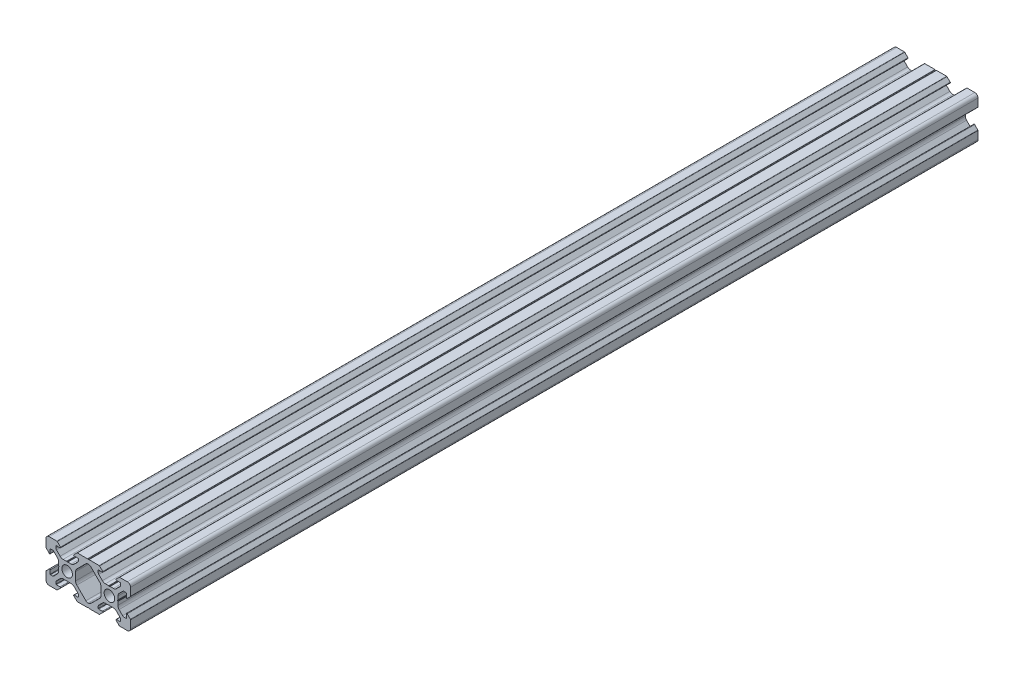
from build123d import *

# Parameters (mm, degrees)
MODEL_R    = 2.5
BODY_DEPTH = 401


with BuildPart() as part:
    # Model → Body (new body)
    with BuildSketch(Plane.XY):
        with BuildLine():
            Line((0.375693909, 9.662304735), (5.17, 9.662304735))
            ThreePointArc((5.17, 9.662304735), (5.265670858, 9.643274618), (5.346776695, 9.58908143))
            Line((5.346776695, 9.58908143), (6.846776695, 8.08908143))
            ThreePointArc((6.846776695, 8.08908143), (6.900969883, 7.816633877), (6.67, 7.662304735))
            Line((6.67, 7.662304735), (4.9, 7.662304735))
            ThreePointArc((4.9, 7.662304735), (4.758578644, 7.603726091), (4.7, 7.462304735))
            Line((4.7, 7.462304735), (4.7, 6.649310504))
            ThreePointArc((4.7, 6.649310504), (4.776120467, 6.266627071), (4.992893219, 5.942203722))
            Line((4.992893219, 5.942203722), (6.687005769, 4.248091173))
            ThreePointArc((6.687005769, 4.248091173), (7.335852466, 3.81454567), (8.101219331, 3.662304735))
            Line((8.101219331, 3.662304735), (9.662304735, 3.662304735))
            ThreePointArc((9.662304735, 3.662304735), (9.745056471, 3.648211815), (9.818478497, 3.607521938))
            Line((9.818478497, 3.607521938), (10, 3.462304735))
            Line((10, 3.462304735), (10.181521503, 3.607521938))
            ThreePointArc((10.181521503, 3.607521938), (10.254943529, 3.648211815), (10.337695265, 3.662304735))
            Line((10.337695265, 3.662304735), (11.898780669, 3.662304735))
            ThreePointArc((11.898780669, 3.662304735), (12.664147534, 3.81454567), (13.312994231, 4.248091173))
            Line((13.312994231, 4.248091173), (15.007106781, 5.942203722))
            ThreePointArc((15.007106781, 5.942203722), (15.223879533, 6.266627071), (15.3, 6.649310504))
            Line((15.3, 6.649310504), (15.3, 7.462304735))
            ThreePointArc((15.3, 7.462304735), (15.241421356, 7.603726091), (15.1, 7.662304735))
            Line((15.1, 7.662304735), (13.33, 7.662304735))
            ThreePointArc((13.33, 7.662304735), (13.099030117, 7.816633877), (13.153223305, 8.08908143))
            Line((13.153223305, 8.08908143), (14.653223305, 9.58908143))
            ThreePointArc((14.653223305, 9.58908143), (14.734329142, 9.643274618), (14.83, 9.662304735))
            Line((14.83, 9.662304735), (18.5, 9.662304735))
            ThreePointArc((18.5, 9.662304735), (19.560660172, 9.222964907), (20, 8.162304735))
            Line((20, 8.162304735), (20, 4.492304735))
            ThreePointArc((20, 4.492304735), (19.980969883, 4.396633877), (19.926776695, 4.31552804))
            Line((19.926776695, 4.31552804), (18.426776695, 2.81552804))
            ThreePointArc((18.426776695, 2.81552804), (18.154329142, 2.761334852), (18, 2.992304735))
            Line((18, 2.992304735), (18, 4.762304735))
            ThreePointArc((18, 4.762304735), (17.941421356, 4.903726091), (17.8, 4.962304735))
            Line((17.8, 4.962304735), (16.987005769, 4.962304735))
            ThreePointArc((16.987005769, 4.962304735), (16.604322336, 4.886184268), (16.279898987, 4.669411516))
            Line((16.279898987, 4.669411516), (14.585786438, 2.975298967))
            ThreePointArc((14.585786438, 2.975298967), (14.152240935, 2.326452269), (14, 1.561085404))
            Line((14, 1.561085404), (14, 0))
            ThreePointArc((14, 0), (13.98590708, -0.082751735), (13.945217202, -0.156173762))
            Line((13.945217202, -0.156173762), (13.8, -0.337695265))
            Line((13.8, -0.337695265), (13.945217202, -0.519216768))
            ThreePointArc((13.945217202, -0.519216768), (13.98590708, -0.592638794), (14, -0.67539053))
            Line((14, -0.67539053), (14, -2.236475934))
            ThreePointArc((14, -2.236475934), (14.152240935, -3.001842799), (14.585786438, -3.650689496))
            Line((14.585786438, -3.650689496), (16.279898987, -5.344802046))
            ThreePointArc((16.279898987, -5.344802046), (16.604322336, -5.561574797), (16.987005769, -5.637695265))
            Line((16.987005769, -5.637695265), (17.8, -5.637695265))
            ThreePointArc((17.8, -5.637695265), (17.941421356, -5.579116621), (18, -5.437695265))
            Line((18, -5.437695265), (18, -3.667695265))
            ThreePointArc((18, -3.667695265), (18.154329142, -3.436725382), (18.426776695, -3.49091857))
            Line((18.426776695, -3.49091857), (19.926776695, -4.99091857))
            ThreePointArc((19.926776695, -4.99091857), (19.980969883, -5.072024407), (20, -5.167695265))
            Line((20, -5.167695265), (20, -8.837695265))
            ThreePointArc((20, -8.837695265), (19.560660172, -9.898355437), (18.5, -10.337695265))
            Line((18.5, -10.337695265), (14.83, -10.337695265))
            ThreePointArc((14.83, -10.337695265), (14.734329142, -10.318665148), (14.653223305, -10.26447196))
            Line((14.653223305, -10.26447196), (13.153223305, -8.76447196))
            ThreePointArc((13.153223305, -8.76447196), (13.099030117, -8.492024407), (13.33, -8.337695265))
            Line((13.33, -8.337695265), (15.1, -8.337695265))
            ThreePointArc((15.1, -8.337695265), (15.241421356, -8.279116621), (15.3, -8.137695265))
            Line((15.3, -8.137695265), (15.3, -7.324701033))
            ThreePointArc((15.3, -7.324701033), (15.223879533, -6.942017601), (15.007106781, -6.617594252))
            Line((15.007106781, -6.617594252), (13.312994231, -4.923481702))
            ThreePointArc((13.312994231, -4.923481702), (12.664147534, -4.4899362), (11.898780669, -4.337695265))
            Line((11.898780669, -4.337695265), (10.337695265, -4.337695265))
            ThreePointArc((10.337695265, -4.337695265), (10.254943529, -4.323602345), (10.181521503, -4.282912467))
            Line((10.181521503, -4.282912467), (10, -4.137695265))
            Line((10, -4.137695265), (9.818478497, -4.282912467))
            ThreePointArc((9.818478497, -4.282912467), (9.745056471, -4.323602345), (9.662304735, -4.337695265))
            Line((9.662304735, -4.337695265), (8.101219331, -4.337695265))
            ThreePointArc((8.101219331, -4.337695265), (7.335852466, -4.4899362), (6.687005769, -4.923481702))
            Line((6.687005769, -4.923481702), (4.992893219, -6.617594252))
            ThreePointArc((4.992893219, -6.617594252), (4.776120467, -6.942017601), (4.7, -7.324701033))
            Line((4.7, -7.324701033), (4.7, -8.137695265))
            ThreePointArc((4.7, -8.137695265), (4.758578644, -8.279116621), (4.9, -8.337695265))
            Line((4.9, -8.337695265), (6.67, -8.337695265))
            ThreePointArc((6.67, -8.337695265), (6.900969883, -8.492024407), (6.846776695, -8.76447196))
            Line((6.846776695, -8.76447196), (5.346776695, -10.26447196))
            ThreePointArc((5.346776695, -10.26447196), (5.265670858, -10.318665148), (5.17, -10.337695265))
            Line((5.17, -10.337695265), (0.375693909, -10.337695265))
            ThreePointArc((0.375693909, -10.337695265), (0.303247872, -10.326968271), (0.23701886, -10.295707838))
            Line((0.23701886, -10.295707838), (0, -10.137695265))
            Line((0, -10.137695265), (-0.23701886, -10.295707838))
            ThreePointArc((-0.23701886, -10.295707838), (-0.303247872, -10.326968271), (-0.375693909, -10.337695265))
            Line((-0.375693909, -10.337695265), (-5.17, -10.337695265))
            ThreePointArc((-5.17, -10.337695265), (-5.265670858, -10.318665148), (-5.346776695, -10.26447196))
            Line((-5.346776695, -10.26447196), (-6.846776695, -8.76447196))
            ThreePointArc((-6.846776695, -8.76447196), (-6.900969883, -8.492024407), (-6.67, -8.337695265))
            Line((-6.67, -8.337695265), (-4.9, -8.337695265))
            ThreePointArc((-4.9, -8.337695265), (-4.758578644, -8.279116621), (-4.7, -8.137695265))
            Line((-4.7, -8.137695265), (-4.7, -7.324701033))
            ThreePointArc((-4.7, -7.324701033), (-4.776120467, -6.942017601), (-4.992893219, -6.617594252))
            Line((-4.992893219, -6.617594252), (-6.687005769, -4.923481702))
            ThreePointArc((-6.687005769, -4.923481702), (-7.335852466, -4.4899362), (-8.101219331, -4.337695265))
            Line((-8.101219331, -4.337695265), (-9.662304735, -4.337695265))
            ThreePointArc((-9.662304735, -4.337695265), (-9.745056471, -4.323602345), (-9.818478497, -4.282912467))
            Line((-9.818478497, -4.282912467), (-10, -4.137695265))
            Line((-10, -4.137695265), (-10.181521503, -4.282912467))
            ThreePointArc((-10.181521503, -4.282912467), (-10.254943529, -4.323602345), (-10.337695265, -4.337695265))
            Line((-10.337695265, -4.337695265), (-11.898780669, -4.337695265))
            ThreePointArc((-11.898780669, -4.337695265), (-12.664147534, -4.4899362), (-13.312994231, -4.923481702))
            Line((-13.312994231, -4.923481702), (-15.007106781, -6.617594252))
            ThreePointArc((-15.007106781, -6.617594252), (-15.223879533, -6.942017601), (-15.3, -7.324701033))
            Line((-15.3, -7.324701033), (-15.3, -8.137695265))
            ThreePointArc((-15.3, -8.137695265), (-15.241421356, -8.279116621), (-15.1, -8.337695265))
            Line((-15.1, -8.337695265), (-13.33, -8.337695265))
            ThreePointArc((-13.33, -8.337695265), (-13.099030117, -8.492024407), (-13.153223305, -8.76447196))
            Line((-13.153223305, -8.76447196), (-14.653223305, -10.26447196))
            ThreePointArc((-14.653223305, -10.26447196), (-14.734329142, -10.318665148), (-14.83, -10.337695265))
            Line((-14.83, -10.337695265), (-18.5, -10.337695265))
            ThreePointArc((-18.5, -10.337695265), (-19.560660172, -9.898355437), (-20, -8.837695265))
            Line((-20, -8.837695265), (-20, -5.167695265))
            ThreePointArc((-20, -5.167695265), (-19.980969883, -5.072024407), (-19.926776695, -4.99091857))
            Line((-19.926776695, -4.99091857), (-18.426776695, -3.49091857))
            ThreePointArc((-18.426776695, -3.49091857), (-18.154329142, -3.436725382), (-18, -3.667695265))
            Line((-18, -3.667695265), (-18, -5.437695265))
            ThreePointArc((-18, -5.437695265), (-17.941421356, -5.579116621), (-17.8, -5.637695265))
            Line((-17.8, -5.637695265), (-16.987005769, -5.637695265))
            ThreePointArc((-16.987005769, -5.637695265), (-16.604322336, -5.561574797), (-16.279898987, -5.344802046))
            Line((-16.279898987, -5.344802046), (-14.585786438, -3.650689496))
            ThreePointArc((-14.585786438, -3.650689496), (-14.152240935, -3.001842799), (-14, -2.236475934))
            Line((-14, -2.236475934), (-14, -0.67539053))
            ThreePointArc((-14, -0.67539053), (-13.98590708, -0.592638794), (-13.945217202, -0.519216768))
            Line((-13.945217202, -0.519216768), (-13.8, -0.337695265))
            Line((-13.8, -0.337695265), (-13.945217202, -0.156173762))
            ThreePointArc((-13.945217202, -0.156173762), (-13.98590708, -0.082751735), (-14, 0))
            Line((-14, 0), (-14, 1.561085404))
            ThreePointArc((-14, 1.561085404), (-14.152240935, 2.326452269), (-14.585786438, 2.975298967))
            Line((-14.585786438, 2.975298967), (-16.279898987, 4.669411516))
            ThreePointArc((-16.279898987, 4.669411516), (-16.604322336, 4.886184268), (-16.987005769, 4.962304735))
            Line((-16.987005769, 4.962304735), (-17.8, 4.962304735))
            ThreePointArc((-17.8, 4.962304735), (-17.941421356, 4.903726091), (-18, 4.762304735))
            Line((-18, 4.762304735), (-18, 2.992304735))
            ThreePointArc((-18, 2.992304735), (-18.154329142, 2.761334852), (-18.426776695, 2.81552804))
            Line((-18.426776695, 2.81552804), (-19.926776695, 4.31552804))
            ThreePointArc((-19.926776695, 4.31552804), (-19.980969883, 4.396633877), (-20, 4.492304735))
            Line((-20, 4.492304735), (-20, 8.162304735))
            ThreePointArc((-20, 8.162304735), (-19.560660172, 9.222964907), (-18.5, 9.662304735))
            Line((-18.5, 9.662304735), (-14.83, 9.662304735))
            ThreePointArc((-14.83, 9.662304735), (-14.734329142, 9.643274618), (-14.653223305, 9.58908143))
            Line((-14.653223305, 9.58908143), (-13.153223305, 8.08908143))
            ThreePointArc((-13.153223305, 8.08908143), (-13.099030117, 7.816633877), (-13.33, 7.662304735))
            Line((-13.33, 7.662304735), (-15.1, 7.662304735))
            ThreePointArc((-15.1, 7.662304735), (-15.241421356, 7.603726091), (-15.3, 7.462304735))
            Line((-15.3, 7.462304735), (-15.3, 6.649310504))
            ThreePointArc((-15.3, 6.649310504), (-15.223879533, 6.266627071), (-15.007106781, 5.942203722))
            Line((-15.007106781, 5.942203722), (-13.312994231, 4.248091173))
            ThreePointArc((-13.312994231, 4.248091173), (-12.664147534, 3.81454567), (-11.898780669, 3.662304735))
            Line((-11.898780669, 3.662304735), (-10.337695265, 3.662304735))
            ThreePointArc((-10.337695265, 3.662304735), (-10.254943529, 3.648211815), (-10.181521503, 3.607521938))
            Line((-10.181521503, 3.607521938), (-10, 3.462304735))
            Line((-10, 3.462304735), (-9.818478497, 3.607521938))
            ThreePointArc((-9.818478497, 3.607521938), (-9.745056471, 3.648211815), (-9.662304735, 3.662304735))
            Line((-9.662304735, 3.662304735), (-8.101219331, 3.662304735))
            ThreePointArc((-8.101219331, 3.662304735), (-7.335852466, 3.81454567), (-6.687005769, 4.248091173))
            Line((-6.687005769, 4.248091173), (-4.992893219, 5.942203722))
            ThreePointArc((-4.992893219, 5.942203722), (-4.776120467, 6.266627071), (-4.7, 6.649310504))
            Line((-4.7, 6.649310504), (-4.7, 7.462304735))
            ThreePointArc((-4.7, 7.462304735), (-4.758578644, 7.603726091), (-4.9, 7.662304735))
            Line((-4.9, 7.662304735), (-6.67, 7.662304735))
            ThreePointArc((-6.67, 7.662304735), (-6.900969883, 7.816633877), (-6.846776695, 8.08908143))
            Line((-6.846776695, 8.08908143), (-5.346776695, 9.58908143))
            ThreePointArc((-5.346776695, 9.58908143), (-5.265670858, 9.643274618), (-5.17, 9.662304735))
            Line((-5.17, 9.662304735), (-0.375693909, 9.662304735))
            ThreePointArc((-0.375693909, 9.662304735), (-0.303247872, 9.651577742), (-0.23701886, 9.620317309))
            Line((-0.23701886, 9.620317309), (0, 9.462304735))
            Line((0, 9.462304735), (0.23701886, 9.620317309))
            ThreePointArc((0.23701886, 9.620317309), (0.303247872, 9.651577742), (0.375693909, 9.662304735))
        make_face()
        with Locations((10, -0.337695265)):
            Circle(MODEL_R, mode=Mode.SUBTRACT)
        with Locations((-10, -0.337695265)):
            Circle(MODEL_R, mode=Mode.SUBTRACT)
        with BuildLine():
            Line((-5.414213562, 2.975298967), (-1.1372583, 7.252254229))
            ThreePointArc((-1.1372583, 7.252254229), (-0.683065612, 7.555736081), (-0.147308807, 7.662304735))
            Line((-0.147308807, 7.662304735), (0.147308807, 7.662304735))
            ThreePointArc((0.147308807, 7.662304735), (0.683065612, 7.555736081), (1.1372583, 7.252254229))
            Line((1.1372583, 7.252254229), (5.414213562, 2.975298967))
            ThreePointArc((5.414213562, 2.975298967), (5.847759065, 2.326452269), (6, 1.561085404))
            Line((6, 1.561085404), (6, -2.236475934))
            ThreePointArc((6, -2.236475934), (5.847759065, -3.001842799), (5.414213562, -3.650689496))
            Line((5.414213562, -3.650689496), (1.1372583, -7.927644759))
            ThreePointArc((1.1372583, -7.927644759), (0.683065612, -8.23112661), (0.147308807, -8.337695265))
            Line((0.147308807, -8.337695265), (-0.147308807, -8.337695265))
            ThreePointArc((-0.147308807, -8.337695265), (-0.683065612, -8.23112661), (-1.1372583, -7.927644759))
            Line((-1.1372583, -7.927644759), (-5.414213562, -3.650689496))
            ThreePointArc((-5.414213562, -3.650689496), (-5.847759065, -3.001842799), (-6, -2.236475934))
            Line((-6, -2.236475934), (-6, 1.561085404))
            ThreePointArc((-6, 1.561085404), (-5.847759065, 2.326452269), (-5.414213562, 2.975298967))
        make_face(mode=Mode.SUBTRACT)
    extrude(amount=BODY_DEPTH)


solid = part.part
